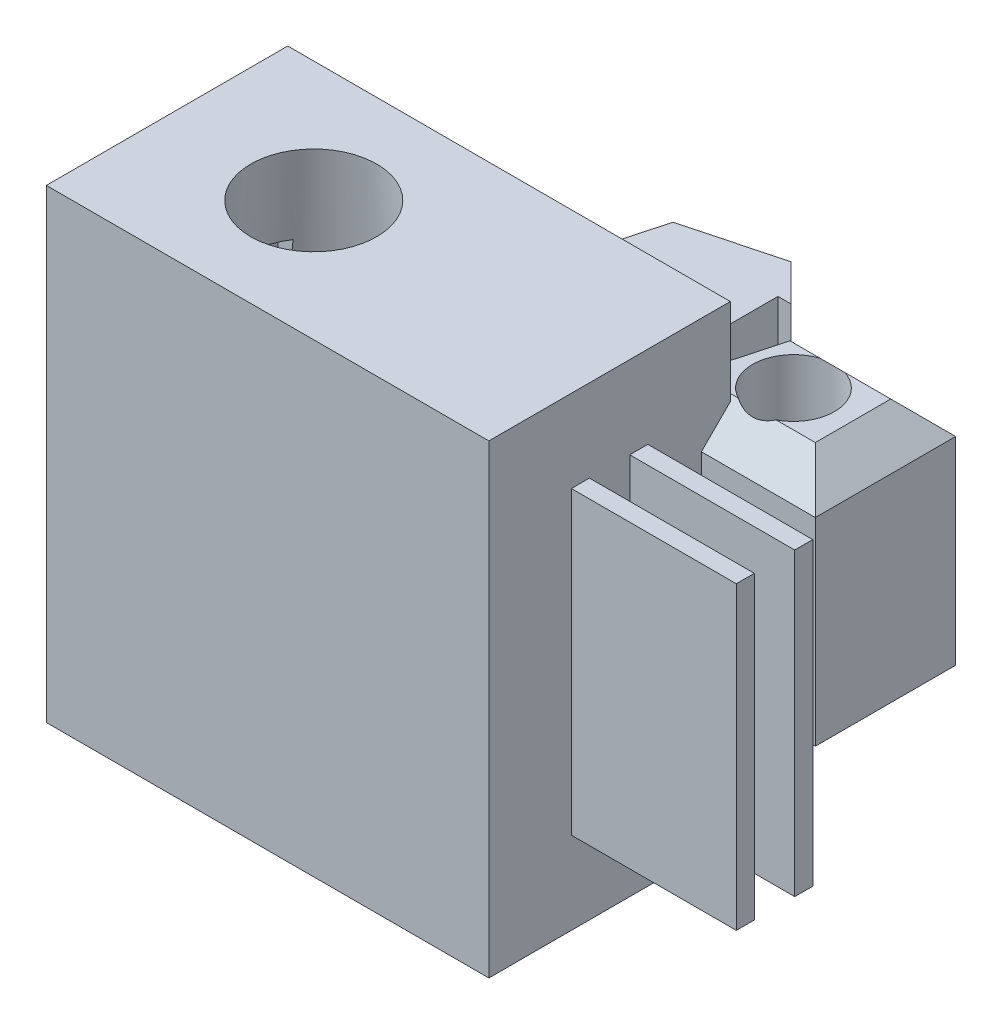
from build123d import *

# Parameters (mm, degrees)
BOSS_EXTRUDE1_DEPTH           = 71
SKETCH1_R                     = 12.612546325
BOSS_EXTRUDE1_2_DEPTH         = 71
CHAMFER1_SIZE                 = 10
BOSS_EXTRUDE2_START           = 25
SKETCH2_R                     = 25.665481482
BOSS_EXTRUDE2_DEPTH           = 55
BOSS_EXTRUDE2_TAPER           = -5
BOSS_EXTRUDE2_OTHER_WAY_DEPTH = 55
BOSS_EXTRUDE2_OTHER_WAY_TAPER = -5
SKETCH2_3_R                   = 25.665481482
CUT_EXTRUDE1_DEPTH            = 127
EXTRUDE_THIN4_START           = -136.285637615
EXTRUDE_THIN4_OUTLINE_W       = 74.349241095
EXTRUDE_THIN4_OUTLINE_H       = 143.248499752
EXTRUDE_THIN4_OUTLINE_W_2     = 23.549241095
EXTRUDE_THIN4_OUTLINE_H_2     = 92.448499752
EXTRUDE_THIN4_DEPTH           = 136.285637615
EXTRUDE_THIN4_START_2         = -81.131505871
EXTRUDE_THIN4_3_OUTLINE_W     = 25.4
EXTRUDE_THIN4_3_OUTLINE_H     = 92.448499752
EXTRUDE_THIN4_3_DEPTH         = 81.131505871
EXTRUDE_THIN4_START_3         = -62.055403382
EXTRUDE_THIN4_5_OUTLINE_W     = 25.4
EXTRUDE_THIN4_5_OUTLINE_H     = 92.448499752
EXTRUDE_THIN4_5_DEPTH         = 62.055403382
EXTRUDE_THIN4_START_4         = -121.585490263
EXTRUDE_THIN4_6_OUTLINE_W     = 25.4
EXTRUDE_THIN4_6_OUTLINE_H     = 92.448499752
EXTRUDE_THIN4_6_DEPTH         = 1.426630024
EXTRUDE_THIN4_START_5         = 65.121304361
EXTRUDE_THIN4_7_OUTLINE_W     = 58.103456857
EXTRUDE_THIN4_7_OUTLINE_H     = 92.448499752
EXTRUDE_THIN4_7_DEPTH         = 25.4
SKETCH3_2_W                   = 5.557193525
SKETCH3_2_H                   = 92.448499752
SKETCH3_2_W_2                 = 5.557193524
BOSS_EXTRUDE3_DEPTH           = 50.8


with BuildPart() as part:
    # Sketch1 → Boss-Extrude1 (new body)
    with BuildSketch(Plane(origin=(0, 0, 0), x_dir=(1, 0, 0), z_dir=(0, 1, 0))):
        Polygon((-17.102724768, -27.50448581), (-17.102724768, 12.593824602), (-13.150491386, 12.593824602), (-24.320277596, 23.833435941), (-53.051166582, 16.230886979), (-60.83261054, -12.452067238), (-39.883165511, -33.532472492), align=None)
    extrude(amount=BOSS_EXTRUDE1_DEPTH)


with BuildPart() as body_2:
    # Sketch1 → Boss-Extrude1 2 (new body)
    with BuildSketch(Plane(origin=(0, 0, 0), x_dir=(1, 0, 0), z_dir=(0, 1, 0))):
        Polygon((37.625994489, 12.593824602), (-13.150491386, 12.593824602), (-3.370832568, 2.753030688), (-11.152276525, -25.929923529), (-17.102724768, -27.50448581), (-17.102724768, -30.629425265), (37.625994489, -30.629425265), align=None)
        with Locations(Location((9.720782427, -9.444950833, 0), (0, 0, 270))):
            Circle(SKETCH1_R, mode=Mode.SUBTRACT)
    extrude(amount=BOSS_EXTRUDE1_2_DEPTH)

    # Chamfer1
    # the kernel refuses this chamfer: 10 mm, written as the material it takes off along each edge
    with BuildSketch(Plane(origin=(63.342824368, 71, -12.593824602), x_dir=(0, -1, 0), z_dir=(-1, 0, 0))) as chamfer1_piece_1:
        Polygon((CHAMFER1_SIZE, 0), (0, CHAMFER1_SIZE), (0, 0), align=None)
    extrude(amount=102.210145634, mode=Mode.SUBTRACT)
    with BuildSketch(Plane(origin=(37.625994489, 71, 56.346255145), x_dir=(0, -1, 0), z_dir=(0, 0, -1))) as chamfer1_piece_2:
        Polygon((CHAMFER1_SIZE, 0), (0, CHAMFER1_SIZE), (0, 0), align=None)
    extrude(amount=94.656909626, mode=Mode.SUBTRACT)
    with BuildSketch(Plane(origin=(-42.819554647, 71, 30.629425265), x_dir=(0, -1, 0), z_dir=(1, 0, 0))) as chamfer1_piece_3:
        Polygon((CHAMFER1_SIZE, 0), (0, CHAMFER1_SIZE), (0, 0), align=None)
    extrude(amount=106.162379015, mode=Mode.SUBTRACT)


with BuildPart() as body_3:
    # Sketch2 → Boss-Extrude2 (new body)
    with BuildSketch(Plane(origin=(0, 0, 0), x_dir=(1, 0, 0), z_dir=(0, 1, 0)).offset(BOSS_EXTRUDE2_START)):
        with Locations((-88.567132287, -58.903877338)):
            Circle(SKETCH2_R)
    extrude(amount=BOSS_EXTRUDE2_DEPTH, taper=BOSS_EXTRUDE2_TAPER)

    # Sketch2 → Boss-Extrude2 other way (add)
    with BuildSketch(Plane(origin=(0, 0, 0), x_dir=(1, 0, 0), z_dir=(0, 1, 0)).offset(BOSS_EXTRUDE2_START)):
        with Locations((-88.567132287, -58.903877338)):
            Circle(SKETCH2_R)
    extrude(amount=-BOSS_EXTRUDE2_OTHER_WAY_DEPTH, taper=BOSS_EXTRUDE2_OTHER_WAY_TAPER)

    # Sketch2<3> → Cut-Extrude1 (cut, symmetric)
    with BuildSketch(Plane(origin=(0, 0, 0), x_dir=(1, 0, 0), z_dir=(0, 1, 0))):
        with Locations(Location((-88.567132287, -58.903877338, 0), (0, 0, 270))):
            Circle(SKETCH2_3_R)
    extrude(amount=CUT_EXTRUDE1_DEPTH, both=True, mode=Mode.SUBTRACT)


with BuildPart() as cut_extrude1_piece_1:
    # of the separate pieces the step leaves, piece 1, a body of its own (cut_extrude1_pieces)
    add(body_3.part.solids().sort_by_distance((-58.089774312, 80, 58.903877338))[0])


with BuildPart() as cut_extrude1_piece_2:
    # of the separate pieces the step leaves, piece 2, a body of its own (cut_extrude1_pieces)
    add(body_3.part.solids().sort_by_distance((-58.089774312, -30, 58.903877338))[0])


with BuildPart() as body_5:
    # Extrude-Thin4: read off the stored shape, not the designer's step
    # Extrude-Thin4 outline → Extrude-Thin4 (new body)
    with BuildSketch(Plane(origin=(2.54, 0, 0), x_dir=(0, 0, -1), z_dir=(1, 0, 0)).offset(EXTRUDE_THIN4_START)):
        with Locations((-58.903877339, 25)):
            Rectangle(EXTRUDE_THIN4_OUTLINE_W, EXTRUDE_THIN4_OUTLINE_H)
        with Locations((-58.903877339, 25)):
            Rectangle(EXTRUDE_THIN4_OUTLINE_W_2, EXTRUDE_THIN4_OUTLINE_H_2, mode=Mode.SUBTRACT)
    extrude(amount=EXTRUDE_THIN4_DEPTH)

    # Extrude-Thin4 2 outline → Extrude-Thin4 2 (revolve, cut)
    with BuildSketch(Plane(origin=(-88.567132287, 0, 58.903877338), x_dir=(1, 0, 0), z_dir=(0, 0, 1))):
        Polygon((0, -46.624249876), (31.931791379, -46.624249876), (19.399171584, 96.624249876), (0, 96.624249876), align=None)
    revolve(axis=Axis((-88.567132287, 0, 58.903877338), (0, 1, 0)), mode=Mode.SUBTRACT)



with BuildPart() as body_6:
    # Extrude-Thin4 3 outline → Extrude-Thin4 3 (new body)
    with BuildSketch(Plane(origin=(2.54, 0, 0), x_dir=(0, 0, -1), z_dir=(1, 0, 0)).offset(EXTRUDE_THIN4_START_2)):
        with Locations((-65.386450315, 25)):
            Rectangle(EXTRUDE_THIN4_3_OUTLINE_W, EXTRUDE_THIN4_3_OUTLINE_H)
    extrude(amount=EXTRUDE_THIN4_3_DEPTH)

    # Extrude-Thin4 4 outline → Extrude-Thin4 4 (revolve, cut)
    with BuildSketch(Plane(origin=(-88.567132287, 0, 58.903877338), x_dir=(1, 0, 0), z_dir=(0, 0, 1))):
        Polygon((0, -21.224249876), (29.709579326, -21.224249876), (21.621383594, 71.224250375), (0, 71.224250375), align=None)
    revolve(axis=Axis((-88.567132287, 0, 58.903877338), (0, 1, 0)), mode=Mode.SUBTRACT)


with BuildPart() as body_7:
    # Extrude-Thin4 5 outline → Extrude-Thin4 5 (new body)
    with BuildSketch(Plane(origin=(2.54, 0, 0), x_dir=(0, 0, -1), z_dir=(1, 0, 0)).offset(EXTRUDE_THIN4_START_3)):
        with Locations((-77.821304361, 25)):
            Rectangle(EXTRUDE_THIN4_5_OUTLINE_W, EXTRUDE_THIN4_5_OUTLINE_H)
    extrude(amount=EXTRUDE_THIN4_5_DEPTH)

    # Extrude-Thin4 6 outline → Extrude-Thin4 6 (add)
    with BuildSketch(Plane(origin=(2.54, 0, 0), x_dir=(0, 0, -1), z_dir=(1, 0, 0)).offset(EXTRUDE_THIN4_START_4)):
        with Locations((-77.821304361, 25)):
            Rectangle(EXTRUDE_THIN4_6_OUTLINE_W, EXTRUDE_THIN4_6_OUTLINE_H)
    extrude(amount=EXTRUDE_THIN4_6_DEPTH)

    # Extrude-Thin4 7 outline → Extrude-Thin4 7 (add)
    with BuildSketch(Plane.XY.offset(EXTRUDE_THIN4_START_5)):
        with Locations((-88.567131811, 25)):
            Rectangle(EXTRUDE_THIN4_7_OUTLINE_W, EXTRUDE_THIN4_7_OUTLINE_H)
    extrude(amount=EXTRUDE_THIN4_7_DEPTH)

    # Extrude-Thin4 8 outline → Extrude-Thin4 8 (revolve, cut)
    with BuildSketch(Plane(origin=(-88.567132287, 0, 58.903877338), x_dir=(1, 0, 0), z_dir=(0, 0, 1))):
        Polygon((0, -21.224249876), (29.709579326, -21.224249876), (21.621383635, 71.224249899), (0, 71.224249899), align=None)
    revolve(axis=Axis((-88.567132287, 0, 58.903877338), (0, 1, 0)), mode=Mode.SUBTRACT)


with BuildPart() as body_5_1:
    add(body_5.part)

    add(body_6.part)  # Boss-Extrude3 merges body 6

    add(body_7.part)  # Boss-Extrude3 merges body 7
    # Sketch3<2> → Boss-Extrude3 (add)
    with BuildSketch(Plane(origin=(2.54, 0, 0), x_dir=(0, 0, -1), z_dir=(1, 0, 0))):
        with Locations((-67.899901124, 25)):
            Rectangle(SKETCH3_2_W, SKETCH3_2_H)
        with Locations((-49.907853553, 25)):
            Rectangle(SKETCH3_2_W_2, SKETCH3_2_H)
    extrude(amount=BOSS_EXTRUDE3_DEPTH)


solid = Compound([part.part, body_2.part, cut_extrude1_piece_1.part, cut_extrude1_piece_2.part, body_5_1.part])
